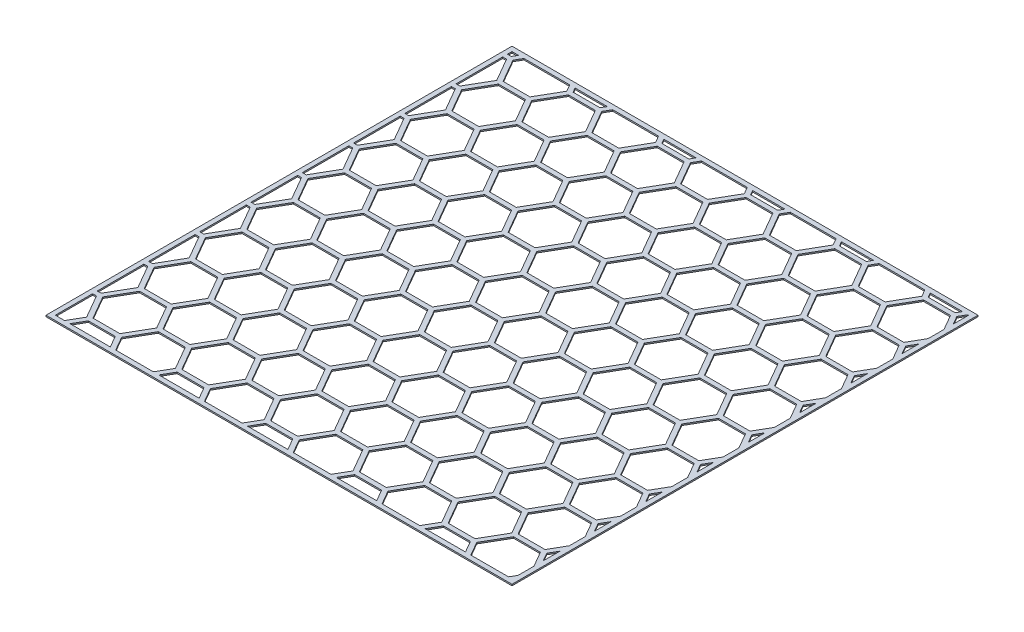
from build123d import *

# Parameters (mm, degrees)
SKETCH1_W           = 1000
SKETCH1_H           = 1000
BASE_FLANGE1_DEPTH  = 3
CUT_EXTRUDE1_DEPTH  = 708.113145119
FILL_START          = -3
FILL_PATTERN5_DEPTH = 3
SKETCH3_W           = 1000
SKETCH3_H           = 1000
SKETCH3_W_2         = 980
SKETCH3_H_2         = 980
BOSS_EXTRUDE1_DEPTH = 3


# Read off the part's stored shape, not the designer's step: Fill Pattern5
# Sheet-metal steps are written as plain solids
with BuildPart() as part:
    # Sketch1 → Base-Flange1 (new body)
    with BuildSketch(Plane(origin=(0, 0, 0), x_dir=(1, 0, 0), z_dir=(0, 1, 0))):
        Rectangle(SKETCH1_W, SKETCH1_H)
    extrude(amount=-BASE_FLANGE1_DEPTH)

    # Sketch2 → Cut-Extrude1 (cut, through all)
    with BuildSketch(Plane(origin=(0, 0, 0), x_dir=(1, 0, 0), z_dir=(0, 1, 0))):
        Polygon((-262.264973081, 310), (-291.132486541, 360), (-348.867513459, 360), (-377.735026919, 310), (-348.867513459, 260), (-291.132486541, 260), align=None)
    extrude(amount=-CUT_EXTRUDE1_DEPTH, mode=Mode.SUBTRACT)

    # Fill Pattern5 outline → Fill Pattern5 (cut)
    with BuildSketch(Plane(origin=(0, 0, 0), x_dir=(1, 0, 0), z_dir=(0, 1, 0)).offset(FILL_START)):
        Polygon((3.316150746, 310), (32.183664206, 260), (89.918691125, 260), (118.786204584, 310), (89.918691125, 360), (32.183664206, 360), align=None)
        Polygon((193.841739579, 310), (222.709253038, 260), (280.444279957, 260), (309.311793417, 310), (280.444279957, 360), (222.709253038, 360), align=None)
        Polygon((384.367328411, 310), (413.234841871, 260), (470.96986879, 260), (499.837382249, 310), (470.96986879, 360), (413.234841871, 360), align=None)
        Polygon((-500, 360), (-500, 260), (-481.658075373, 260), (-452.790561914, 310), (-481.658075373, 360), align=None)
        Polygon((-481.658075373, 250), (-500, 250), (-500, 150), (-481.658075373, 150), (-452.790561914, 200), align=None)
        Polygon((-500, 470), (-500, 370), (-481.658075373, 370), (-452.790561914, 420), (-481.658075373, 470), align=None)
        Polygon((-481.658075373, 140), (-500, 140), (-500, 40), (-481.658075373, 40), (-452.790561914, 90), align=None)
        Polygon((-500, 500), (-500, 480), (-481.658075373, 480), (-470.111069989, 500), align=None)
        Polygon((-481.658075373, 30), (-500, 30), (-500, -70), (-481.658075373, -70), (-452.790561914, -20), align=None)
        Polygon((-371.961524227, 500), (-458.564064606, 500), (-472.997821335, 475), (-444.130307876, 425), (-386.395280957, 425), (-357.527767497, 475), align=None)
        Polygon((-481.658075373, -80), (-500, -80), (-500, -180), (-481.658075373, -180), (-452.790561914, -130), align=None)
        Polygon((-279.585481157, 500), (-360.414518843, 500), (-348.867513459, 480), (-291.132486541, 480), align=None)
        Polygon((-481.658075373, -190), (-500, -190), (-500, -290), (-481.658075373, -290), (-452.790561914, -240), align=None)
        Polygon((-181.435935394, 500), (-268.038475773, 500), (-282.472232503, 475), (-253.604719043, 425), (-195.869692124, 425), (-167.002178665, 475), align=None)
        Polygon((-481.658075373, -300), (-500, -300), (-500, -400), (-481.658075373, -400), (-452.790561914, -350), align=None)
        Polygon((-89.059892324, 500), (-169.888930011, 500), (-158.341924627, 480), (-100.606897708, 480), align=None)
        Polygon((-481.658075373, -410), (-500, -410), (-500, -500), (-475.884572681, -500), (-452.790561914, -460), align=None)
        Polygon((9.089653438, 500), (-77.51288694, 500), (-91.94664367, 475), (-63.079130211, 425), (-5.344103292, 425), (23.523410168, 475), align=None)
        Polygon((-444.130307876, -465), (-464.337567297, -500), (-366.188021535, -500), (-386.395280957, -465), align=None)
        Polygon((101.465696508, 500), (20.636658822, 500), (32.183664206, 480), (89.918691125, 480), align=None)
        Polygon((-377.735026919, -460), (-354.641016151, -500), (-285.358983849, -500), (-262.264973081, -460), (-291.132486541, -410), (-348.867513459, -410), align=None)
        Polygon((199.615242271, 500), (113.012701892, 500), (98.578945162, 475), (127.446458622, 425), (185.181485541, 425), (214.048999, 475), align=None)
        Polygon((-253.604719043, -465), (-273.811978465, -500), (-175.662432703, -500), (-195.869692124, -465), align=None)
        Polygon((291.991285341, 500), (211.162247654, 500), (222.709253038, 480), (280.444279957, 480), align=None)
        Polygon((-187.209438086, -460), (-164.115427319, -500), (-94.833395016, -500), (-71.739384248, -460), (-100.606897708, -410), (-158.341924627, -410), align=None)
        Polygon((390.140831103, 500), (303.538290725, 500), (289.104533995, 475), (317.972047455, 425), (375.707074374, 425), (404.574587833, 475), align=None)
        Polygon((-63.079130211, -465), (-83.286389632, -500), (14.86315613, -500), (-5.344103292, -465), align=None)
        Polygon((482.516874174, 500), (401.687836487, 500), (413.234841871, 480), (470.96986879, 480), align=None)
        Polygon((3.316150746, -460), (26.410161514, -500), (95.692193817, -500), (118.786204584, -460), (89.918691125, -410), (32.183664206, -410), align=None)
        Polygon((500, 500), (494.063879557, 500), (479.630122828, 475), (500, 439.718337794), align=None)
        Polygon((127.446458622, -465), (107.2391992, -500), (205.388744963, -500), (185.181485541, -465), align=None)
        Polygon((500, 329.718337794), (500, 400.281662206), (479.630122828, 365), align=None)
        Polygon((193.841739579, -460), (216.935750346, -500), (286.217782649, -500), (309.311793417, -460), (280.444279957, -410), (222.709253038, -410), align=None)
        Polygon((500, 219.718337794), (500, 290.281662206), (479.630122828, 255), align=None)
        Polygon((317.972047455, -465), (297.764788033, -500), (395.914333795, -500), (375.707074373, -465), align=None)
        Polygon((500, 109.718337794), (500, 180.281662206), (479.630122828, 145), align=None)
        Polygon((384.367328411, -460), (407.461339179, -500), (476.743371482, -500), (499.837382249, -460), (470.96986879, -410), (413.234841871, -410), align=None)
        Polygon((500, -0.281662206), (500, 70.281662206), (479.630122828, 35), align=None)
        Polygon((500, -479.718337794), (488.290376865, -500), (500, -500), align=None)
        Polygon((500, -110.281662206), (500, -39.718337794), (479.630122828, -75), align=None)
        Polygon((479.630122828, -405), (500, -440.281662206), (500, -369.718337794), align=None)
        Polygon((500, -220.281662206), (500, -149.718337794), (479.630122828, -185), align=None)
        Polygon((479.630122828, -295), (500, -330.281662206), (500, -259.718337794), align=None)
        Polygon((-187.209438086, 310), (-158.341924627, 260), (-100.606897708, 260), (-71.739384248, 310), (-100.606897708, 360), (-158.341924627, 360), align=None)
        Polygon((-63.079130211, -135), (-91.94664367, -185), (-63.079130211, -235), (-5.344103292, -235), (23.523410168, -185), (-5.344103292, -135), align=None)
        Polygon((32.183664206, -300), (3.316150746, -350), (32.183664206, -400), (89.918691125, -400), (118.786204584, -350), (89.918691125, -300), align=None)
        Polygon((-158.341924627, 30), (-187.209438086, -20), (-158.341924627, -70), (-100.606897708, -70), (-71.739384248, -20), (-100.606897708, 30), align=None)
        Polygon((-253.604719043, 195), (-282.472232503, 145), (-253.604719043, 95), (-195.869692124, 95), (-167.002178665, 145), (-195.869692124, 195), align=None)
        Polygon((-386.395280957, 195), (-444.130307876, 195), (-472.997821335, 145), (-444.130307876, 95), (-386.395280957, 95), (-357.527767497, 145), align=None)
        Polygon((-63.079130211, -345), (-5.344103292, -345), (23.523410168, -295), (-5.344103292, -245), (-63.079130211, -245), (-91.94664367, -295), align=None)
        Polygon((32.183664206, -180), (89.918691125, -180), (118.786204584, -130), (89.918691125, -80), (32.183664206, -80), (3.316150746, -130), align=None)
        Polygon((222.709253038, 150), (280.444279957, 150), (309.311793417, 200), (280.444279957, 250), (222.709253038, 250), (193.841739579, 200), align=None)
        Polygon((317.972047455, 315), (375.707074374, 315), (404.574587833, 365), (375.707074373, 415), (317.972047455, 415), (289.104533995, 365), align=None)
        Polygon((127.446458622, -15), (185.181485541, -15), (214.048999, 35), (185.181485541, 85), (127.446458622, 85), (98.578945162, 35), align=None)
        Polygon((289.104533995, -405), (317.972047455, -455), (375.707074374, -455), (404.574587833, -405), (375.707074373, -355), (317.972047455, -355), align=None)
        Polygon((98.578945162, -405), (127.446458622, -455), (185.181485541, -455), (214.048999, -405), (185.181485541, -355), (127.446458622, -355), align=None)
        Polygon((-472.997821335, -405), (-444.130307876, -455), (-386.395280957, -455), (-357.527767497, -405), (-386.395280957, -355), (-444.130307876, -355), align=None)
        Polygon((-91.94664367, -405), (-63.079130211, -455), (-5.344103292, -455), (23.523410168, -405), (-5.344103292, -355), (-63.079130211, -355), align=None)
        Polygon((-282.472232503, -405), (-253.604719043, -455), (-195.869692124, -455), (-167.002178665, -405), (-195.869692124, -355), (-253.604719043, -355), align=None)
        Polygon((222.709253038, -190), (193.841739579, -240), (222.709253038, -290), (280.444279957, -290), (309.311793417, -240), (280.444279957, -190), align=None)
        Polygon((-158.341924627, 470), (-187.209438086, 420), (-158.341924627, 370), (-100.606897708, 370), (-71.739384248, 420), (-100.606897708, 470), align=None)
        Polygon((127.446458622, -25), (98.578945162, -75), (127.446458622, -125), (185.181485541, -125), (214.048999, -75), (185.181485541, -25), align=None)
        Polygon((-63.079130211, 305), (-91.94664367, 255), (-63.079130211, 205), (-5.344103292, 205), (23.523410168, 255), (-5.344103292, 305), align=None)
        Polygon((32.183664206, 140), (3.316150746, 90), (32.183664206, 40), (89.918691125, 40), (118.786204584, 90), (89.918691125, 140), align=None)
        Polygon((470.96986879, -190), (413.234841871, -190), (384.367328411, -240), (413.234841871, -290), (470.96986879, -290), (499.837382249, -240), align=None)
        Polygon((193.841739579, -350), (222.709253038, -400), (280.444279957, -400), (309.311793417, -350), (280.444279957, -300), (222.709253038, -300), align=None)
        Polygon((384.367328411, -350), (413.234841871, -400), (470.96986879, -400), (499.837382249, -350), (470.96986879, -300), (413.234841871, -300), align=None)
        Polygon((-187.209438086, -350), (-158.341924627, -400), (-100.606897708, -400), (-71.739384248, -350), (-100.606897708, -300), (-158.341924627, -300), align=None)
        Polygon((-377.735026919, -350), (-348.867513459, -400), (-291.132486541, -400), (-262.264973081, -350), (-291.132486541, -300), (-348.867513459, -300), align=None)
        Polygon((127.446458622, -135), (98.578945162, -185), (127.446458622, -235), (185.181485541, -235), (214.048999, -185), (185.181485541, -135), align=None)
        Polygon((32.183664206, 30), (3.316150746, -20), (32.183664206, -70), (89.918691125, -70), (118.786204584, -20), (89.918691125, 30), align=None)
        Polygon((-63.079130211, 195), (-91.94664367, 145), (-63.079130211, 95), (-5.344103292, 95), (23.523410168, 145), (-5.344103292, 195), align=None)
        Polygon((375.707074374, -135), (317.972047455, -135), (289.104533995, -185), (317.972047455, -235), (375.707074374, -235), (404.574587833, -185), align=None)
        Polygon((470.96986879, 30), (413.234841871, 30), (384.367328411, -20), (413.234841871, -70), (470.96986879, -70), (499.837382249, -20), align=None)
        Polygon((317.972047455, -245), (289.104533995, -295), (317.972047455, -345), (375.707074374, -345), (404.574587833, -295), (375.707074373, -245), align=None)
        Polygon((-63.079130211, 415), (-91.94664367, 365), (-63.079130211, 315), (-5.344103292, 315), (23.523410168, 365), (-5.344103292, 415), align=None)
        Polygon((222.709253038, -80), (193.841739579, -130), (222.709253038, -180), (280.444279957, -180), (309.311793417, -130), (280.444279957, -80), align=None)
        Polygon((32.183664206, 250), (3.316150746, 200), (32.183664206, 150), (89.918691125, 150), (118.786204584, 200), (89.918691125, 250), align=None)
        Polygon((-282.472232503, -185), (-253.604719043, -235), (-195.869692124, -235), (-167.002178665, -185), (-195.869692124, -135), (-253.604719043, -135), align=None)
        Polygon((-472.997821335, -185), (-444.130307876, -235), (-386.395280957, -235), (-357.527767497, -185), (-386.395280957, -135), (-444.130307876, -135), align=None)
        Polygon((185.181485541, 195), (127.446458622, 195), (98.578945162, 145), (127.446458622, 95), (185.181485541, 95), (214.048999, 145), align=None)
        Polygon((-187.209438086, -130), (-158.341924627, -180), (-100.606897708, -180), (-71.739384248, -130), (-100.606897708, -80), (-158.341924627, -80), align=None)
        Polygon((-377.735026919, -130), (-348.867513459, -180), (-291.132486541, -180), (-262.264973081, -130), (-291.132486541, -80), (-348.867513459, -80), align=None)
        Polygon((384.367328411, -130), (413.234841871, -180), (470.96986879, -180), (499.837382249, -130), (470.96986879, -80), (413.234841871, -80), align=None)
        Polygon((-253.604719043, 85), (-282.472232503, 35), (-253.604719043, -15), (-195.869692124, -15), (-167.002178665, 35), (-195.869692124, 85), align=None)
        Polygon((-348.867513459, 250), (-377.735026919, 200), (-348.867513459, 150), (-291.132486541, 150), (-262.264973081, 200), (-291.132486541, 250), align=None)
        Polygon((-444.130307876, 415), (-472.997821335, 365), (-444.130307876, 315), (-386.395280957, 315), (-357.527767497, 365), (-386.395280957, 415), align=None)
        Polygon((-195.869692124, -245), (-253.604719043, -245), (-282.472232503, -295), (-253.604719043, -345), (-195.869692124, -345), (-167.002178665, -295), align=None)
        Polygon((185.181485541, 415), (127.446458622, 415), (98.578945162, 365), (127.446458622, 315), (185.181485541, 315), (214.048999, 365), align=None)
        Polygon((-5.344103292, 85), (-63.079130211, 85), (-91.94664367, 35), (-63.079130211, -15), (-5.344103292, -15), (23.523410168, 35), align=None)
        Polygon((98.578945162, -295), (127.446458622, -345), (185.181485541, -345), (214.048999, -295), (185.181485541, -245), (127.446458622, -245), align=None)
        Polygon((-472.997821335, -295), (-444.130307876, -345), (-386.395280957, -345), (-357.527767497, -295), (-386.395280957, -245), (-444.130307876, -245), align=None)
        Polygon((-253.604719043, 415), (-282.472232503, 365), (-253.604719043, 315), (-195.869692124, 315), (-167.002178665, 365), (-195.869692124, 415), align=None)
        Polygon((-158.341924627, 250), (-187.209438086, 200), (-158.341924627, 150), (-100.606897708, 150), (-71.739384248, 200), (-100.606897708, 250), align=None)
        Polygon((470.96986879, 250), (413.234841871, 250), (384.367328411, 200), (413.234841871, 150), (470.96986879, 150), (499.837382249, 200), align=None)
        Polygon((375.707074374, 85), (317.972047455, 85), (289.104533995, 35), (317.972047455, -15), (375.707074374, -15), (404.574587833, 35), align=None)
        Polygon((3.316150746, -240), (32.183664206, -290), (89.918691125, -290), (118.786204584, -240), (89.918691125, -190), (32.183664206, -190), align=None)
        Polygon((-187.209438086, -240), (-158.341924627, -290), (-100.606897708, -290), (-71.739384248, -240), (-100.606897708, -190), (-158.341924627, -190), align=None)
        Polygon((-377.735026919, -240), (-348.867513459, -290), (-291.132486541, -290), (-262.264973081, -240), (-291.132486541, -190), (-348.867513459, -190), align=None)
        Polygon((-63.079130211, -25), (-91.94664367, -75), (-63.079130211, -125), (-5.344103292, -125), (23.523410168, -75), (-5.344103292, -25), align=None)
        Polygon((-348.867513459, 470), (-377.735026919, 420), (-348.867513459, 370), (-291.132486541, 370), (-262.264973081, 420), (-291.132486541, 470), align=None)
        Polygon((-158.341924627, 140), (-187.209438086, 90), (-158.341924627, 40), (-100.606897708, 40), (-71.739384248, 90), (-100.606897708, 140), align=None)
        Polygon((-253.604719043, 305), (-282.472232503, 255), (-253.604719043, 205), (-195.869692124, 205), (-167.002178665, 255), (-195.869692124, 305), align=None)
        Polygon((375.707074374, 305), (317.972047455, 305), (289.104533995, 255), (317.972047455, 205), (375.707074374, 205), (404.574587833, 255), align=None)
        Polygon((470.96986879, 470), (413.234841871, 470), (384.367328411, 420), (413.234841871, 370), (470.96986879, 370), (499.837382249, 420), align=None)
        Polygon((280.444279957, 140), (222.709253038, 140), (193.841739579, 90), (222.709253038, 40), (280.444279957, 40), (309.311793417, 90), align=None)
        Polygon((-348.867513459, 140), (-377.735026919, 90), (-348.867513459, 40), (-291.132486541, 40), (-262.264973081, 90), (-291.132486541, 140), align=None)
        Polygon((-253.604719043, -25), (-282.472232503, -75), (-253.604719043, -125), (-195.869692124, -125), (-167.002178665, -75), (-195.869692124, -25), align=None)
        Polygon((-444.130307876, 305), (-472.997821335, 255), (-444.130307876, 205), (-386.395280957, 205), (-357.527767497, 255), (-386.395280957, 305), align=None)
        Polygon((185.181485541, 305), (127.446458622, 305), (98.578945162, 255), (127.446458622, 205), (185.181485541, 205), (214.048999, 255), align=None)
        Polygon((280.444279957, 470), (222.709253038, 470), (193.841739579, 420), (222.709253038, 370), (280.444279957, 370), (309.311793417, 420), align=None)
        Polygon((470.96986879, 140), (413.234841871, 140), (384.367328411, 90), (413.234841871, 40), (470.96986879, 40), (499.837382249, 90), align=None)
        Polygon((375.707074374, -25), (317.972047455, -25), (289.104533995, -75), (317.972047455, -125), (375.707074374, -125), (404.574587833, -75), align=None)
        Polygon((375.707074374, 195), (317.972047455, 195), (289.104533995, 145), (317.972047455, 95), (375.707074374, 95), (404.574587833, 145), align=None)
        Polygon((280.444279957, 30), (222.709253038, 30), (193.841739579, -20), (222.709253038, -70), (280.444279957, -70), (309.311793417, -20), align=None)
        Polygon((-472.997821335, -75), (-444.130307876, -125), (-386.395280957, -125), (-357.527767497, -75), (-386.395280957, -25), (-444.130307876, -25), align=None)
        Polygon((-377.735026919, -20), (-348.867513459, -70), (-291.132486541, -70), (-262.264973081, -20), (-291.132486541, 30), (-348.867513459, 30), align=None)
        Polygon((-444.130307876, 85), (-472.997821335, 35), (-444.130307876, -15), (-386.395280957, -15), (-357.527767497, 35), (-386.395280957, 85), align=None)
        Polygon((32.183664206, 470), (3.316150746, 420), (32.183664206, 370), (89.918691125, 370), (118.786204584, 420), (89.918691125, 470), align=None)
    extrude(amount=FILL_PATTERN5_DEPTH, mode=Mode.SUBTRACT)

    # Sketch3 → Boss-Extrude1 (add)
    with BuildSketch(Plane(origin=(0, 0, 0), x_dir=(1, 0, 0), z_dir=(0, 1, 0))):
        Rectangle(SKETCH3_W, SKETCH3_H)
        Rectangle(SKETCH3_W_2, SKETCH3_H_2, mode=Mode.SUBTRACT)
    extrude(amount=-BOSS_EXTRUDE1_DEPTH)


solid = part.part
